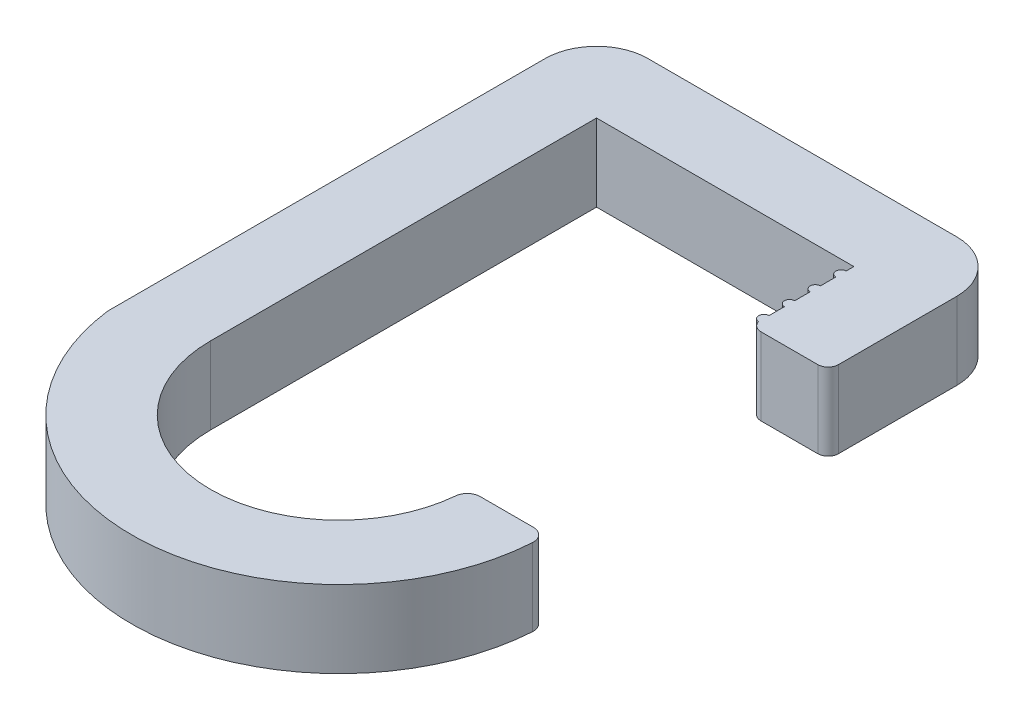
from build123d import *

# Parameters (mm, degrees)
BOSS_EXTRUDE1_DEPTH = 15
FILLET1_R           = 10
FILLET3_R           = 2
FILLET6_R           = 2.5


with BuildPart() as part:
    # Sketch1 → Boss-Extrude1 (new body)
    with BuildSketch(Plane(origin=(0, 0, 0), x_dir=(1, 0, 0), z_dir=(0, 1, 0))):
        with BuildLine():
            Line((65, -75), (80.311288741, -75))
            ThreePointArc((80.311288741, -75), (42.504840348, -115.233391292), (0, -80))
            Line((0, -80), (0, -50))
            Line((0, -50), (0, 0))
            Line((0, 0), (0, 15))
            Line((0, 15), (80, 15))
            Line((80, 15), (80, 0))
            Line((80, 0), (80, -20))
            Line((80, -20), (65, -20))
            Line((65, -20), (65, -18.5))
            ThreePointArc((65, -18.5), (64, -17.5), (65, -16.5))
            Line((65, -16.5), (65, -13.5))
            ThreePointArc((65, -13.5), (64, -12.5), (65, -11.5))
            Line((65, -11.5), (65, -8.5))
            ThreePointArc((65, -8.5), (64, -7.5), (65, -6.5))
            Line((65, -6.5), (65, -3.5))
            ThreePointArc((65, -3.5), (64, -2.5), (65, -1.5))
            Line((65, -1.5), (65, 0))
            Line((65, 0), (15, 0))
            Line((15, 0), (15, -50))
            Line((15, -50), (15, -75))
            ThreePointArc((15, -75), (40, -100), (65, -75))
        make_face()
    extrude(amount=BOSS_EXTRUDE1_DEPTH)

    # Fillet1
    fillet1_edges = [part.edges().sort_by_distance(p)[0] for p in [
        (0, 7.5, -15),
        (80, 7.5, -15),
    ]]
    fillet(fillet1_edges, radius=FILLET1_R)

    # Fillet3
    # the kernel refuses this fillet: 2 mm, written as the material it takes off along each edge
    with BuildSketch(Plane(origin=(80, -5, 20), x_dir=(0, 0, -1), z_dir=(0, 1, 0))) as fillet3_piece_1:
        with BuildLine():
            CenterArc((FILLET3_R, FILLET3_R), FILLET3_R, 180, 90)
            Line((0, FILLET3_R), (-FILLET3_R * 0.02, FILLET3_R))
            Line((-FILLET3_R * 0.02, FILLET3_R), (-FILLET3_R * 0.02, -FILLET3_R * 0.02))
            Line((-FILLET3_R * 0.02, -FILLET3_R * 0.02), (FILLET3_R, -FILLET3_R * 0.02))
            Line((FILLET3_R, -FILLET3_R * 0.02), (FILLET3_R, 0))
        make_face()
    extrude(amount=25, mode=Mode.SUBTRACT)
    with BuildSketch(Plane(origin=(65, -4.841229183, 20), x_dir=(1, 0, 0), z_dir=(0, 1, 0))) as fillet3_piece_2:
        with BuildLine():
            CenterArc((1.936491673, 2), FILLET3_R, 194.477512186, 75.522487814)
            Line((0, 1.5), (-0.038729833, 1.49))
            ThreePointArc((-0.038729833, 1.49), (-0.04, 0.75), (-0.04, 0))
            Line((-0.04, 0), (0, -0.04))
            Line((0, -0.04), (1.936491673, -0.04))
            Line((1.936491673, -0.04), (1.936491673, 0))
        make_face()
    extrude(amount=24.682458366, mode=Mode.SUBTRACT)

    # Fillet6
    fillet6_edges = [part.edges().sort_by_distance(p)[0] for p in [
        (65, 7.5, 75),
        (80.311288741, 7.5, 75),
    ]]
    fillet(fillet6_edges, radius=FILLET6_R)


solid = part.part
